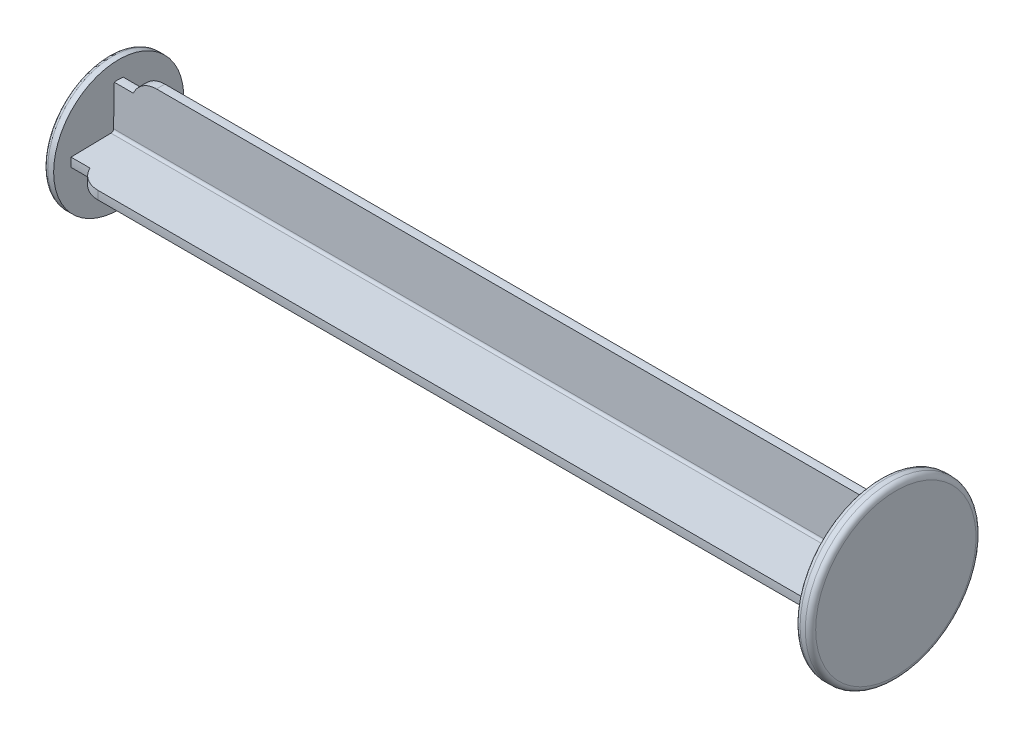
from build123d import *

# Parameters (mm, degrees)
BOSS_EXTRUDE4_START   = 53.880055185
BOSS_EXTRUDE4_2_DEPTH = 71.319944815
BOSS_EXTRUDE4_START_2 = 52.05
BOSS_EXTRUDE4_3_DEPTH = 4.040129852
SKETCH26_R            = 8.2
BOSS_EXTRUDE5_DEPTH   = 1.5
FILLET8_R             = 0.25
FILLET9_R             = 0.4
FILLET10_R            = 0.5


with BuildPart() as part:
    # Boss-Extrude4: read off the stored shape, not the designer's step
    # Boss-Extrude4 outline → Boss-Extrude4 (revolve)
    with BuildSketch(Plane.YX):
        with BuildLine():
            Line((0, 52.05), (0, 50.45))
            add(Edge.make_bspline(
                [(6.25, 51.15), (3.15111586, 50.566822676), (0, 50.45)],
                knots=[1.384782418, 1.384782418, 1.384782418, 1.533739867, 1.533739867, 1.533739867], degree=2, weights=[1, 0.997227742, 1]))
            Line((6.25, 51.15), (6.25, 52.05))
            Line((6.25, 52.05), (0, 52.05))
        make_face()
    revolve(axis=Axis((0, 0, 0), (1, 0, 0)))



with BuildPart() as body_2:
    # Boss-Extrude4 2 outline → Boss-Extrude4 2 (new body)
    with BuildSketch(Plane.YZ.offset(BOSS_EXTRUDE4_START)):
        with BuildLine():
            Line((-0.496702112, -0.496702112), (-0.40023184, -6.023480263))
            ThreePointArc((-0.40023184, -6.023480263), (0, -6.036762377), (0.40023184, -6.023480263))
            Line((0.40023184, -6.023480263), (0.496702112, -0.496702112))
            Line((0.496702112, -0.496702112), (6.023480263, -0.40023184))
            ThreePointArc((6.023480263, -0.40023184), (6.036762377, 0), (6.023480263, 0.40023184))
            Line((6.023480263, 0.40023184), (0.496702112, 0.496702112))
            Line((0.496702112, 0.496702112), (0.40023184, 6.023480263))
            ThreePointArc((0.40023184, 6.023480263), (0, 6.036762377), (-0.40023184, 6.023480263))
            Line((-0.40023184, 6.023480263), (-0.496702112, 0.496702112))
            Line((-0.496702112, 0.496702112), (-6.023480263, 0.40023184))
            ThreePointArc((-6.023480263, 0.40023184), (-6.036762377, 0), (-6.023480263, -0.40023184))
            Line((-6.023480263, -0.40023184), (-0.496702112, -0.496702112))
        make_face()
    extrude(amount=BOSS_EXTRUDE4_2_DEPTH)


with BuildPart() as part_1:
    add(part.part)

    add(body_2.part)  # Boss-Extrude4 3 merges body 2
    # Boss-Extrude4 3 outline → Boss-Extrude4 3 (add)
    with BuildSketch(Plane.YZ.offset(BOSS_EXTRUDE4_START_2)):
        with BuildLine():
            Line((-4.58028551, -0.425422898), (-0.496702112, -0.496702112))
            Line((-0.496702112, -0.496702112), (-0.425422898, -4.58028551))
            ThreePointArc((-0.425422898, -4.58028551), (0, -4.6), (0.425422898, -4.58028551))
            Line((0.425422898, -4.58028551), (0.496702112, -0.496702112))
            Line((0.496702112, -0.496702112), (4.58028551, -0.425422898))
            ThreePointArc((4.58028551, -0.425422898), (4.6, 0), (4.58028551, 0.425422898))
            Line((4.58028551, 0.425422898), (0.496702112, 0.496702112))
            Line((0.496702112, 0.496702112), (0.425422898, 4.58028551))
            ThreePointArc((0.425422898, 4.58028551), (0, 4.6), (-0.425422898, 4.58028551))
            Line((-0.425422898, 4.58028551), (-0.496702112, 0.496702112))
            Line((-0.496702112, 0.496702112), (-4.58028551, 0.425422898))
            ThreePointArc((-4.58028551, 0.425422898), (-4.6, 0), (-4.58028551, -0.425422898))
        make_face()
    extrude(amount=BOSS_EXTRUDE4_3_DEPTH)

    # Boss-Extrude4 4 outline → Boss-Extrude4 4 (revolve, cut)
    with BuildSketch(Plane.YX):
        with BuildLine():
            Line((6.036762378, 53.880055185), (6.036762377, 56.090129852))
            ThreePointArc((6.036762377, 56.090129852), (5.645999412, 54.772109014), (4.6, 53.880055286))
            Line((4.6, 53.880055286), (6.036762378, 53.880055185))
        make_face()
    revolve(axis=Axis((0, 0, 0), (1, 0, 0)), mode=Mode.SUBTRACT)

    # Sketch26 → Boss-Extrude5 (add)
    with BuildSketch(Plane.ZY.offset(-125.2)):
        Circle(SKETCH26_R)
    extrude(amount=-BOSS_EXTRUDE5_DEPTH)

    # Fillet8
    fillet8_edges = [part_1.edges().sort_by_distance(p)[0] for p in [
        (89.540027592, 0.496702112, -0.496702112),
        (89.540027592, -0.496702112, -0.496702112),
        (89.540027592, -0.496702112, 0.496702112),
        (89.540027592, 0.496702112, 0.496702112),
    ]]
    fillet(fillet8_edges, radius=FILLET8_R)

    # Fillet9
    fillet9_edges = [part_1.edges().sort_by_distance(p)[0] for p in [
        (51.15, -6.25, 0),
    ]]
    fillet(fillet9_edges, radius=FILLET9_R)

    # Fillet10
    fillet10_edges = [part_1.edges().sort_by_distance(p)[0] for p in [
        (126.7, 0, -8.2),
        (125.2, 0, -8.2),
    ]]
    fillet(fillet10_edges, radius=FILLET10_R)


solid = part_1.part
